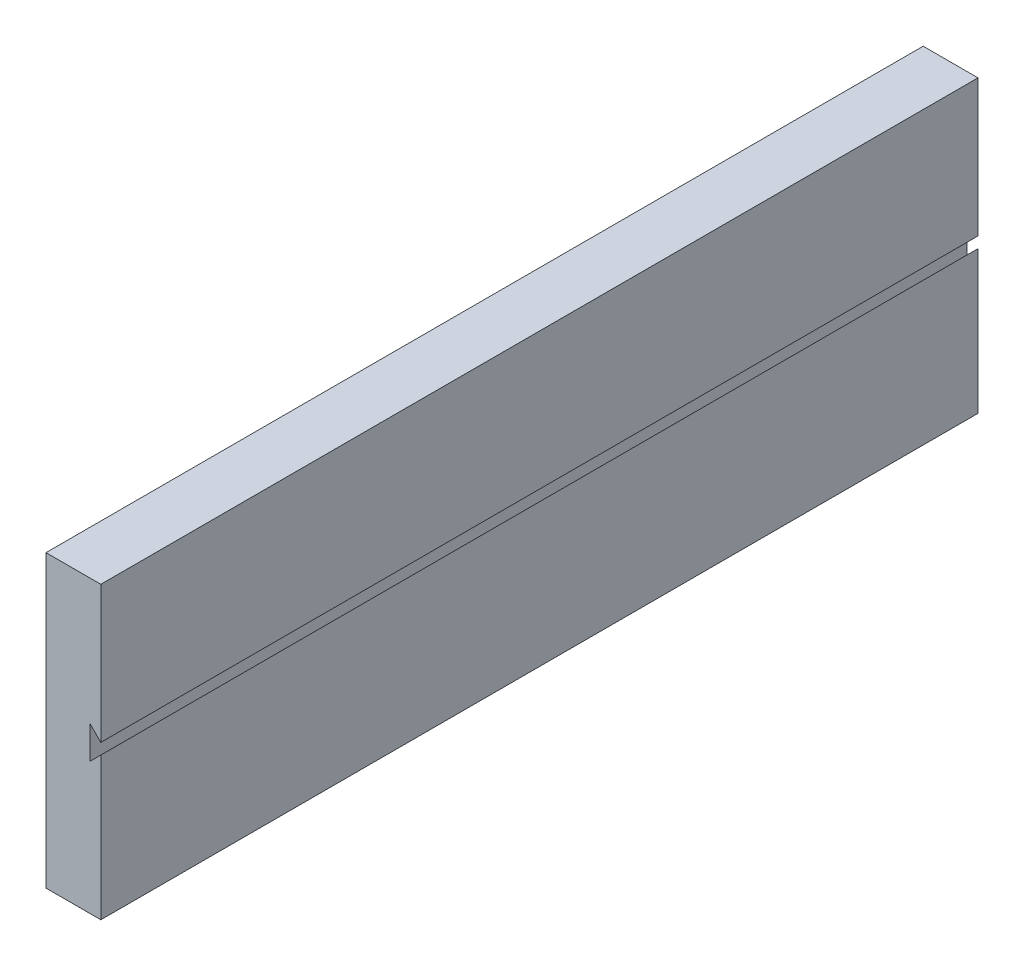
from build123d import *

# Parameters (mm, degrees)
SKETCH1_W               = 160
SKETCH1_H               = 53
BOSS_EXTRUDE1_DEPTH     = 10
CUT_EXTRUDE2_DEPTH      = 169.846083757
CUT_EXTRUDE2_DEPTH_BACK = 169.846083757


with BuildPart() as part:
    # Sketch1 → Boss-Extrude1 (new body)
    with BuildSketch(Plane(origin=(0, 0, 0), x_dir=(0, 0, -1), z_dir=(1, 0, 0))):
        with Locations((80, 26.5)):
            Rectangle(SKETCH1_W, SKETCH1_H)
    extrude(amount=BOSS_EXTRUDE1_DEPTH)

    # Sketch4 → Cut-Extrude2 (cut, two sides: drawn at the far end of the back side and taken through both)
    with BuildSketch(Plane.XY.offset(-CUT_EXTRUDE2_DEPTH_BACK)):
        Polygon((59.152546933, 75.177989704), (10, 26.025442771), (8, 24.025442771), (8, 30.025442771), (10, 28.025442771), (59.152546933, -21.127104162), (-79.871850062, -21.127104162), (-79.871850062, 75.177989704), align=None)
    extrude(amount=CUT_EXTRUDE2_DEPTH + CUT_EXTRUDE2_DEPTH_BACK, mode=Mode.SUBTRACT)


solid = part.part
